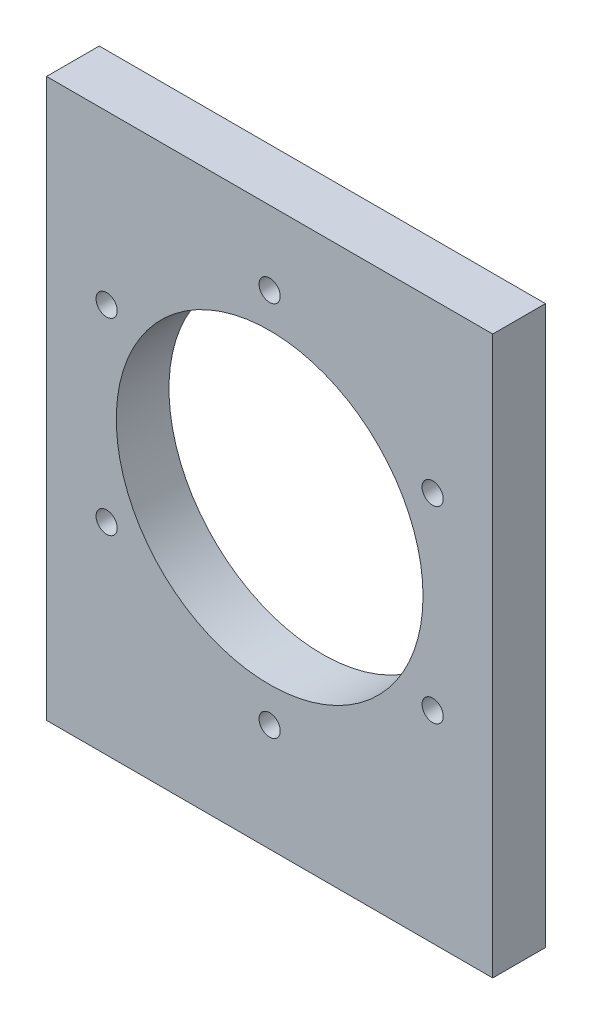
from build123d import *

# Parameters (mm, degrees)
SKETCH1_W           = 101.6
SKETCH1_H           = 127
SKETCH1_R           = 34.925
SKETCH1_R_2         = 2.413
BOSS_EXTRUDE1_DEPTH = 12.0000014


with BuildPart() as part:
    # Sketch1 → Boss-Extrude1 (new body)
    with BuildSketch(Plane.XY):
        with Locations((0, 63.5)):
            Rectangle(SKETCH1_W, SKETCH1_H)
        with Locations((0, 67.3749986)):
            Circle(SKETCH1_R, mode=Mode.SUBTRACT)
        with Locations((-37.12001387, 45.9437486)):
            Circle(SKETCH1_R_2, mode=Mode.SUBTRACT)
        with Locations((37.12001387, 45.9437486)):
            Circle(SKETCH1_R_2, mode=Mode.SUBTRACT)
        with Locations((0, 24.5124986)):
            Circle(SKETCH1_R_2, mode=Mode.SUBTRACT)
        with Locations((-37.12001387, 88.8062486)):
            Circle(SKETCH1_R_2, mode=Mode.SUBTRACT)
        with Locations((37.12001387, 88.8062486)):
            Circle(SKETCH1_R_2, mode=Mode.SUBTRACT)
        with Locations((0, 110.2374986)):
            Circle(SKETCH1_R_2, mode=Mode.SUBTRACT)
    extrude(amount=BOSS_EXTRUDE1_DEPTH)


solid = part.part
